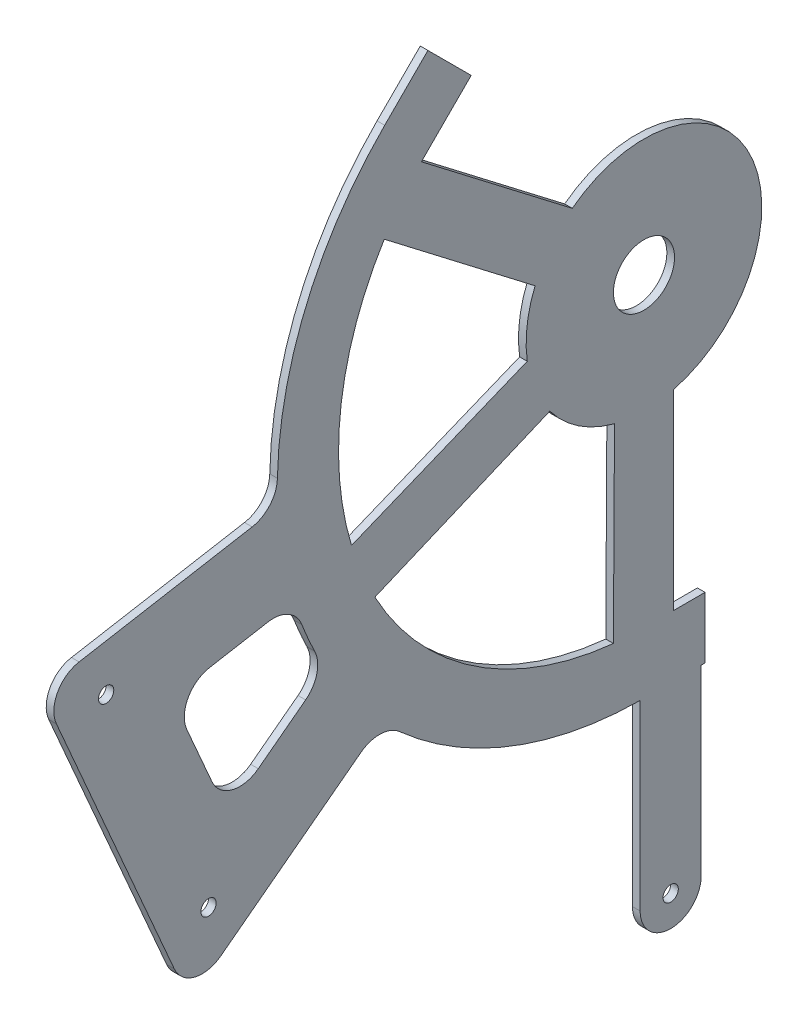
from build123d import *

# Parameters (mm, degrees)
BOSS_EXTRUDE2_DEPTH = 3.175
SKETCH11_W          = 25.4
SKETCH11_H          = 25.436159883
BOSS_EXTRUDE4_DEPTH = 3.175
SKETCH12_R          = 3.175
BOSS_EXTRUDE5_DEPTH = 3.175
SKETCH13_R          = 3.175
BOSS_EXTRUDE6_DEPTH = 3.175
SKETCH14_R          = 12.7
BOSS_EXTRUDE7_DEPTH = 3.175


with BuildPart() as part:
    # Sketch9 → Boss-Extrude2 (new body)
    with BuildSketch(Plane(origin=(0, 0, 0), x_dir=(0, 0, -1), z_dir=(1, 0, 0))):
        with BuildLine():
            Line((0, -126.954378983), (0, -152.390538866))
            ThreePointArc((0, -152.390538866), (-140.790499807, -58.317334473), (-107.756383421, 107.756383421))
            Line((-107.756383421, 107.756383421), (-89.795871179, 125.716895663))
            Line((-89.795871179, 125.716895663), (-71.809790038, 107.730814523))
            Line((-71.809790038, 107.730814523), (-89.770302281, 89.770302281))
            ThreePointArc((-89.770302281, 89.770302281), (-117.290552306, -48.583337503), (0, -126.954378983))
        make_face()
    extrude(amount=BOSS_EXTRUDE2_DEPTH)

    # Sketch11 → Boss-Extrude4 (add)
    with BuildSketch(Plane(origin=(0, 0, 0), x_dir=(0, 0, -1), z_dir=(1, 0, 0))):
        with Locations((12.7, -139.672458925)):
            Rectangle(SKETCH11_W, SKETCH11_H)
    extrude(amount=BOSS_EXTRUDE4_DEPTH)

    # Sketch12 → Boss-Extrude5 (add)
    with BuildSketch(Plane(origin=(0, 0, 0), x_dir=(0, 0, -1), z_dir=(1, 0, 0))):
        with BuildLine():
            ThreePointArc((-1.596710848, -228.181271676), (11.103289152, -240.881271676), (23.803289152, -228.181271676))
            Line((23.803289152, -228.181271676), (23.803289152, -152.390538866))
            Line((23.803289152, -152.390538866), (0, -152.390538866))
            ThreePointArc((0, -152.390538866), (-0.79836638, -152.388447551), (-1.596710848, -152.382173664))
            Line((-1.596710848, -152.382173664), (-1.596710848, -228.181271676))
        make_face()
        with Locations((11.103289152, -228.181271676)):
            Circle(SKETCH12_R, mode=Mode.SUBTRACT)
    extrude(amount=BOSS_EXTRUDE5_DEPTH)

    # Sketch13 → Boss-Extrude6 (add)
    with BuildSketch(Plane(origin=(0, 0, 0), x_dir=(0, 0, -1), z_dir=(1, 0, 0))):
        with BuildLine():
            Line((-175.921744047, -157.217647079), (-117.615441364, -113.032446562))
            ThreePointArc((-117.615441364, -113.032446562), (-109.43511183, -110.464604073), (-101.487144145, -113.680411283))
            ThreePointArc((-101.487144145, -113.680411283), (-121.45550521, -92.040407377), (-136.889329567, -66.964078331))
            ThreePointArc((-136.889329567, -66.964078331), (-135.942652679, -75.485545881), (-140.626971786, -82.666685125))
            Line((-140.626971786, -82.666685125), (-160.306949591, -97.58040329))
            ThreePointArc((-160.306949591, -97.58040329), (-171.19425961, -99.744336405), (-179.624122676, -92.522595986))
            Line((-179.624122676, -92.522595986), (-190.009209059, -68.638532465))
            ThreePointArc((-190.009209059, -68.638532465), (-189.548026602, -57.559851452), (-180.560256724, -51.066019389))
            Line((-180.560256724, -51.066019389), (-156.267984197, -46.797896728))
            ThreePointArc((-156.267984197, -46.797896728), (-147.818260582, -48.251780205), (-142.218034883, -54.744012368))
            ThreePointArc((-142.218034883, -54.744012368), (-150.091480412, -26.370890083), (-152.361266177, 2.986788389))
            ThreePointArc((-152.361266177, 2.986788389), (-155.413049284, -5.02559117), (-162.861116025, -9.272697026))
            Line((-162.861116025, -9.272697026), (-234.783717211, -21.90941035))
            ThreePointArc((-234.783717211, -21.90941035), (-243.771487088, -28.403242413), (-244.232669546, -39.481923426))
            Line((-244.232669546, -39.481923426), (-195.238917132, -152.159839775))
            ThreePointArc((-195.238917132, -152.159839775), (-186.809054067, -159.381580194), (-175.921744047, -157.217647079))
        make_face()
        with Locations((-180.989788445, -137.156185968)):
            Circle(SKETCH13_R, mode=Mode.SUBTRACT)
        with Locations((-223.548763187, -39.27724509)):
            Circle(SKETCH13_R, mode=Mode.SUBTRACT)
    extrude(amount=BOSS_EXTRUDE6_DEPTH)

    # Sketch14 → Boss-Extrude7 (add)
    with BuildSketch(Plane(origin=(0, 0, 0), x_dir=(0, 0, -1), z_dir=(1, 0, 0))):
        with BuildLine():
            Line((-29.799778624, 38.874174032), (-100.328890576, 92.993065071))
            Line((-100.328890576, 92.993065071), (-115.791430873, 72.841890227))
            Line((-115.791430873, 72.841890227), (-45.262318921, 18.722999189))
            ThreePointArc((-45.262318921, 18.722999189), (-48.592985775, 6.160352763), (-48.502549248, -6.836002425))
            Line((-48.502549248, -6.836002425), (-121.562281943, -36.60636491))
            ThreePointArc((-121.562281943, -36.60636491), (-117.290552306, -48.583337503), (-111.842122761, -60.072905036))
            Line((-111.842122761, -60.072905036), (-39.130265149, -29.462697807))
            ThreePointArc((-39.130265149, -29.462697807), (-27.212895153, -40.726975705), (-12.2454793, -47.426537396))
            Line((-12.2454793, -47.426537396), (-12.7, -126.317553583))
            ThreePointArc((-12.7, -126.317553583), (-6.357978189, -126.795072682), (0, -126.954378983))
            Line((0, -126.954378983), (12.2454793, -126.954378983))
            Line((12.2454793, -126.954378983), (12.2454793, -47.426537396))
            ThreePointArc((12.2454793, -47.426537396), (44.033981815, 21.453127004), (-29.799778624, 38.874174032))
        make_face()
        Circle(SKETCH14_R, mode=Mode.SUBTRACT)
    extrude(amount=BOSS_EXTRUDE7_DEPTH)


solid = part.part
